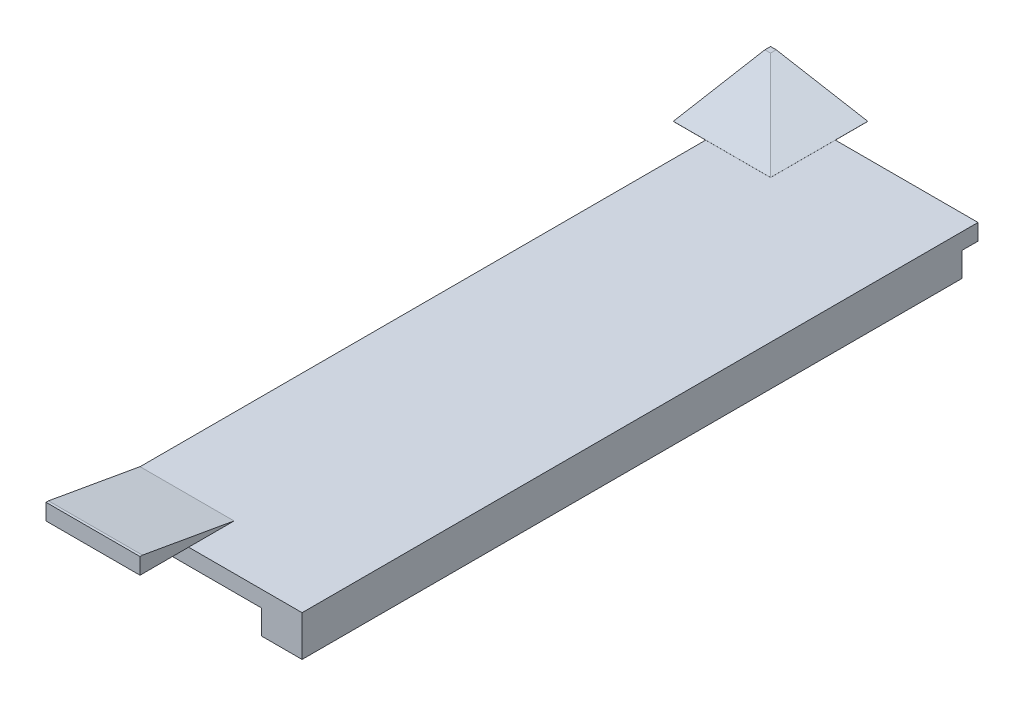
from build123d import *
from OCP.BRepFilletAPI import BRepFilletAPI_MakeChamfer

# Parameters (mm, degrees)
SKETCH1_W           = 25.6
SKETCH1_H           = 83.4
BOSS_EXTRUDE1_DEPTH = 2
SKETCH2_W           = 11.6
SKETCH2_H           = 11.6
SKETCH2_W_2         = 12
SKETCH2_H_2         = 12
BOSS_EXTRUDE2_DEPTH = 2
CHAMFER1_SIZE       = 11.3
CHAMFER1_SIZE2      = 1.992494882
SKETCH4_W           = 5
SKETCH4_H           = 81.4
BOSS_EXTRUDE3_DEPTH = 3


with BuildPart() as part:
    # Sketch1 → Boss-Extrude1 (new body)
    with BuildSketch(Plane(origin=(0, 0, 0), x_dir=(1, 0, 0), z_dir=(0, 1, 0))):
        with Locations((12.8, 41.7)):
            Rectangle(SKETCH1_W, SKETCH1_H)
    extrude(amount=BOSS_EXTRUDE1_DEPTH)

    # Sketch2 → Boss-Extrude2 (add)
    with BuildSketch(Plane(origin=(0, 2, 0), x_dir=(1, 0, 0), z_dir=(0, 1, 0))):
        with Locations((5.8, -0.2)):
            Rectangle(SKETCH2_W, SKETCH2_H)
        with Locations((2, 81.4)):
            Rectangle(SKETCH2_W_2, SKETCH2_H_2)
    extrude(amount=BOSS_EXTRUDE2_DEPTH)

    # Chamfer1: one chamfer whose edges measure the first distance from different faces: ONE call of the kernel's chamfer builder (chamfer() names one face for all edges)
    chamfer1_edges_1 = [part.edges().sort_by_distance(p)[0] for p in [
        (5.8, 4, -5.6),
    ]]
    chamfer1_side_1 = [part.faces().sort_by_distance(p)[0] for p in [
        (5.8, 4, 0.2),
    ]]
    chamfer1_edges_2 = [part.edges().sort_by_distance(p)[0] for p in [
        (8, 4, -81.4),
        (2, 4, -75.4),
    ]]
    chamfer1_side_2 = [part.faces().sort_by_distance(p)[0] for p in [
        (2, 4, -81.4),
    ]]
    chamfer1 = BRepFilletAPI_MakeChamfer(part.part.solid().wrapped)
    for e in chamfer1_edges_1:
        chamfer1.Add(CHAMFER1_SIZE, CHAMFER1_SIZE2, e.wrapped, chamfer1_side_1[0].wrapped)  # the first distance lies on this face
    for e in chamfer1_edges_2:
        chamfer1.Add(CHAMFER1_SIZE, CHAMFER1_SIZE2, e.wrapped, chamfer1_side_2[0].wrapped)  # the first distance lies on this face
    add(Compound.cast(chamfer1.Shape()), mode=Mode.REPLACE)

    # Sketch4 → Boss-Extrude3 (add)
    with BuildSketch(Plane.XZ):
        with Locations((23.1, -40.7)):
            Rectangle(SKETCH4_W, SKETCH4_H)
    extrude(amount=BOSS_EXTRUDE3_DEPTH)


solid = part.part
